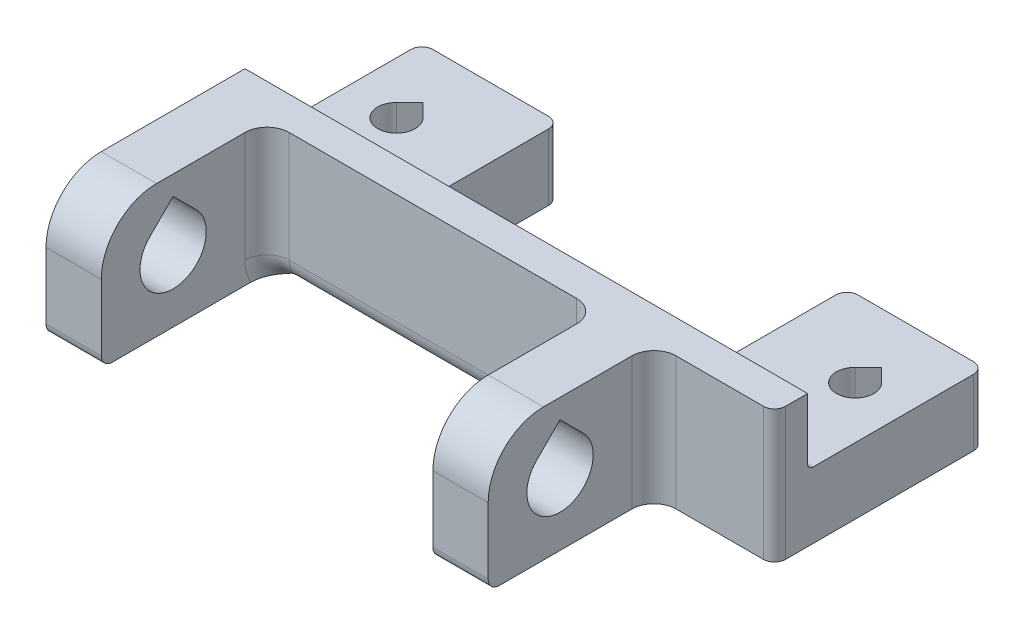
from build123d import *

# Parameters (mm, degrees)
BOSS_EXTRUDE2_DEPTH = 6
BOSS_EXTRUDE4_DEPTH = 12
CUT_EXTRUDE4_DEPTH  = 56.306509563
FILLET3_R           = 5
FILLET7_R           = 2
FILLET4_R           = 2
FILLET5_R           = 0.5
FILLET6_R           = 1


with BuildPart() as part:
    # Sketch1 → Boss-Extrude2 (new body)
    with BuildSketch(Plane(origin=(0, 0, 0), x_dir=(1, 0, 0), z_dir=(0, 1, 0))):
        Polygon((13, 5), (-13, 5), (-13, 16), (-25.45, 16), (-25.45, 0), (25.45, 0), (25.45, 16), (13, 16), align=None)
        with BuildLine():
            ThreePointArc((-19.547918472, 10.202081528), (-20.75, 7.3), (-21.952081528, 10.202081528))
            Line((-21.952081528, 10.202081528), (-20.75, 11.404163056))
            Line((-20.75, 11.404163056), (-19.547918472, 10.202081528))
        make_face(mode=Mode.SUBTRACT)
        with BuildLine():
            Line((20.75, 11.404163056), (21.952081528, 10.202081528))
            ThreePointArc((21.952081528, 10.202081528), (20.75, 7.3), (19.547918472, 10.202081528))
            Line((19.547918472, 10.202081528), (20.75, 11.404163056))
        make_face(mode=Mode.SUBTRACT)
    extrude(amount=BOSS_EXTRUDE2_DEPTH)

    # Sketch1<4> → Boss-Extrude4 (add)
    with BuildSketch(Plane(origin=(0, 0, 0), x_dir=(1, 0, 0), z_dir=(0, 1, 0))):
        Polygon((25.45, 0), (-25.45, 0), (-25.45, -18), (-20.45, -18), (-20.45, -3), (9.55, -3), (9.55, -18), (14.55, -18), (14.55, -3), (25.45, -3), align=None)
    extrude(amount=BOSS_EXTRUDE4_DEPTH)

    # Sketch9 → Cut-Extrude4 (cut, through all)
    with BuildSketch(Plane.ZY.offset(25.45)):
        with BuildLine():
            Line((9.378679656, 8.121320344), (11.5, 10.242640687))
            Line((11.5, 10.242640687), (13.621320344, 8.121320344))
            ThreePointArc((13.621320344, 8.121320344), (11.5, 3), (9.378679656, 8.121320344))
        make_face()
    extrude(amount=-CUT_EXTRUDE4_DEPTH, mode=Mode.SUBTRACT)

    # Fillet3
    fillet3_edges = [part.edges().sort_by_distance(p)[0] for p in [
        (-22.95, 12, 18),
        (12.05, 12, 18),
    ]]
    fillet(fillet3_edges, radius=FILLET3_R)

    # Fillet7
    fillet7_edges = [part.edges().sort_by_distance(p)[0] for p in [
        (-5.45, 0, 3),
    ]]
    fillet(fillet7_edges, radius=FILLET7_R)

    # Fillet4
    # the kernel refuses this fillet: 2 mm, written as the material it adds along each edge
    with BuildSketch(Plane(origin=(9.55, 2, 1), x_dir=(0, 0.8017442392976483, -0.5976672776328277), z_dir=(0, 0.5976672776328277, 0.8017442392976483))) as fillet4_piece_1_section:
        with BuildLine():
            CenterArc((2 + FILLET4_R, FILLET4_R), FILLET4_R, 180, 90)
            Line((2, FILLET4_R), (2, 0))
            Line((2, 0), (2 + FILLET4_R, 0))
        make_face()
    fillet4_piece_1 = revolve(axis=Axis((9.55, 2, 1), (-1, 0, 0)), revolution_arc=233.296989237, mode=Mode.PRIVATE)
    fillet4_piece_1 = split(fillet4_piece_1, bisect_by=Plane(origin=(8.926743459, 0, 2.499877942), z_dir=(0, 1, 0)), keep=Keep.TOP, mode=Mode.PRIVATE)
    add(fillet4_piece_1)
    with BuildSketch(Plane(origin=(-20.45, 2, 1), x_dir=(0, 0.8017442392976483, -0.5976672776328277), z_dir=(0, 0.5976672776328277, 0.8017442392976483))) as fillet4_piece_2_section:
        with BuildLine():
            CenterArc((2 + FILLET4_R, -FILLET4_R), FILLET4_R, 90, 90)
            Line((2 + FILLET4_R, 0), (2, 0))
            Line((2, 0), (2, -FILLET4_R))
        make_face()
    fillet4_piece_2 = revolve(axis=Axis((-20.45, 2, 1), (-1, 0, 0)), revolution_arc=233.296989237, mode=Mode.PRIVATE)
    fillet4_piece_2 = split(fillet4_piece_2, bisect_by=Plane(origin=(-19.826743524, 0, 2.499877995), z_dir=(0, 1, 0)), keep=Keep.TOP, mode=Mode.PRIVATE)
    add(fillet4_piece_2)
    with BuildSketch(Plane(origin=(14.55, 0, 3), x_dir=(1, 0, 0), z_dir=(0, 1, 0))) as fillet4_piece_3:
        with BuildLine():
            CenterArc((FILLET4_R, -FILLET4_R), FILLET4_R, 90, 90)
            Line((0, -FILLET4_R), (0, 0))
            Line((0, 0), (FILLET4_R, 0))
        make_face()
    extrude(amount=12)
    with BuildSketch(Plane(origin=(-20.45, 2, 3), x_dir=(1, 0, 0), z_dir=(0, 1, 0))) as fillet4_piece_4:
        with BuildLine():
            CenterArc((FILLET4_R, -FILLET4_R), FILLET4_R, 90, 90)
            Line((0, -FILLET4_R), (0, 0))
            Line((0, 0), (FILLET4_R, 0))
        make_face()
    extrude(amount=10)
    with BuildSketch(Plane(origin=(9.55, 2, 3), x_dir=(-1, 0, 0), z_dir=(0, 1, 0))) as fillet4_piece_5:
        with BuildLine():
            CenterArc((FILLET4_R, FILLET4_R), FILLET4_R, 180, 90)
            Line((0, FILLET4_R), (0, 0))
            Line((0, 0), (FILLET4_R, 0))
        make_face()
    extrude(amount=10)

    # Fillet5
    fillet5_edges = [part.edges().sort_by_distance(p)[0] for p in [
        (0, 6, 0),
    ]]
    fillet(fillet5_edges, radius=FILLET5_R)

    # Fillet6
    fillet6_edges = [part.edges().sort_by_distance(p)[0] for p in [
        (-25.45, 3, -16),
        (-13, 3, -16),
        (13, 3, -16),
        (25.45, 3, -16),
        (25.45, 6, 3),
        (-22.95, 0, 18),
        (12.05, 0, 18),
    ]]
    fillet(fillet6_edges, radius=FILLET6_R)


solid = part.part
